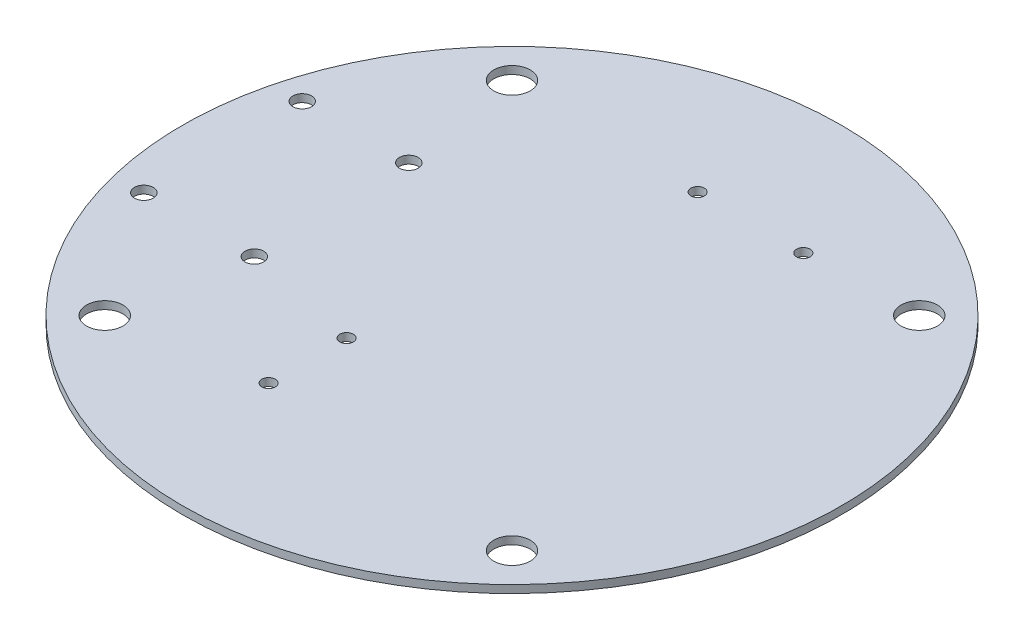
from build123d import *

# Parameters (mm, degrees)
SKETCH1_R            = 63.4
BOSS_EXTRUDE1_DEPTH  = 1.5
M6_CLEARANCE_HOLE1_D = 7
CIRPATTERN1_COUNT    = 4
M2_CLEARANCE_HOLE1_D = 2.6
M3_CLEARANCE_HOLE2_D = 3.6


with BuildPart() as part:
    # Sketch1 → Boss-Extrude1 (new body)
    with BuildSketch(Plane(origin=(0, 0, 0), x_dir=(1, 0, 0), z_dir=(0, 1, 0))):
        Circle(SKETCH1_R)
    extrude(amount=BOSS_EXTRUDE1_DEPTH)

    # M6 Clearance Hole1 (through all)
    with Locations(Plane(origin=(0, 1.5, 0), x_dir=(1, 0, 0), z_dir=(0, 1, 0))):
        with Locations((-39.173715678, -39.173715678)):
            m6_clearance_hole1 = Hole(M6_CLEARANCE_HOLE1_D / 2)

    # CirPattern1: M6 Clearance Hole1 ×4 about axis
    cirpattern1_axis = Axis((0, 1.5, 0), (0, -1, 0))
    for i in range(1, CIRPATTERN1_COUNT):
        add(m6_clearance_hole1.rotate(cirpattern1_axis, i * 360 / CIRPATTERN1_COUNT), mode=Mode.SUBTRACT)

    # M2 Clearance Hole1 (through all)
    with Locations(Plane(origin=(0, 1.5, 0), x_dir=(1, 0, 0), z_dir=(0, 1, 0))):
        with Locations((-2.709999951, 38.430000111), (17.610000128, 38.430000136), (-12.154, -19.673715678), (-12.154, -34.673715678)):
            Hole(M2_CLEARANCE_HOLE1_D / 2)

    # M3 Clearance Hole2 (through all)
    with Locations(Plane(origin=(0, 1.5, 0), x_dir=(1, 0, 0), z_dir=(0, 1, 0))):
        with Locations((-55.86454119, 15.511690642), (-55.864546519, -14.968309358), (-34.604546519, -14.968313075), (-35.36654119, 15.511687058)):
            Hole(M3_CLEARANCE_HOLE2_D / 2)


solid = part.part
